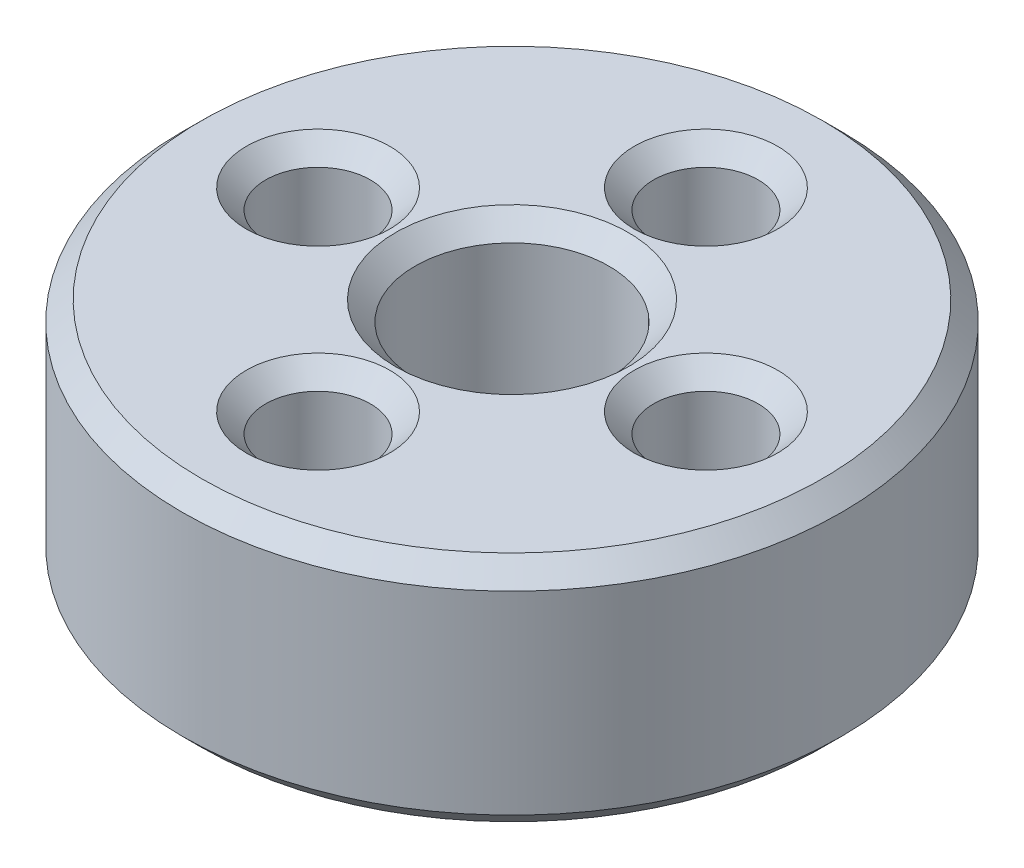
from build123d import *

# Parameters (mm, degrees)
SKETCH_1_R      = 8.5
SKETCH_1_R_2    = 1.35
SKETCH_1_R_3    = 2.5
EXTRUDE_1_DEPTH = 6
CHAMFER_1_SIZE  = 0.5


with BuildPart() as part:
    # 草图1 → 凸台-拉伸1 (new body)
    with BuildSketch(Plane(origin=(0, 0, 0), x_dir=(1, 0, 0), z_dir=(0, 1, 0))):
        Circle(SKETCH_1_R)
        with Locations((-5, 0)):
            Circle(SKETCH_1_R_2, mode=Mode.SUBTRACT)
        with Locations((0, 5)):
            Circle(SKETCH_1_R_2, mode=Mode.SUBTRACT)
        with Locations((5, 0)):
            Circle(SKETCH_1_R_2, mode=Mode.SUBTRACT)
        with Locations((0, -5)):
            Circle(SKETCH_1_R_2, mode=Mode.SUBTRACT)
        Circle(SKETCH_1_R_3, mode=Mode.SUBTRACT)
    extrude(amount=EXTRUDE_1_DEPTH)

    # 倒角1
    chamfer_1_edges = [part.edges().sort_by_distance(p)[0] for p in [
        (-1.35, 0, 5),
        (3.65, 0, 0),
        (-1.35, 0, -5),
        (-2.5, 0, 0),
        (-6.35, 0, 0),
        (-8.5, 0, 0),
        (-1.35, 6, 5),
        (-1.35, 6, -5),
        (-6.35, 6, 0),
        (-8.5, 6, 0),
        (-2.5, 6, 0),
        (3.65, 6, 0),
    ]]
    chamfer(chamfer_1_edges, length=CHAMFER_1_SIZE)


solid = part.part
